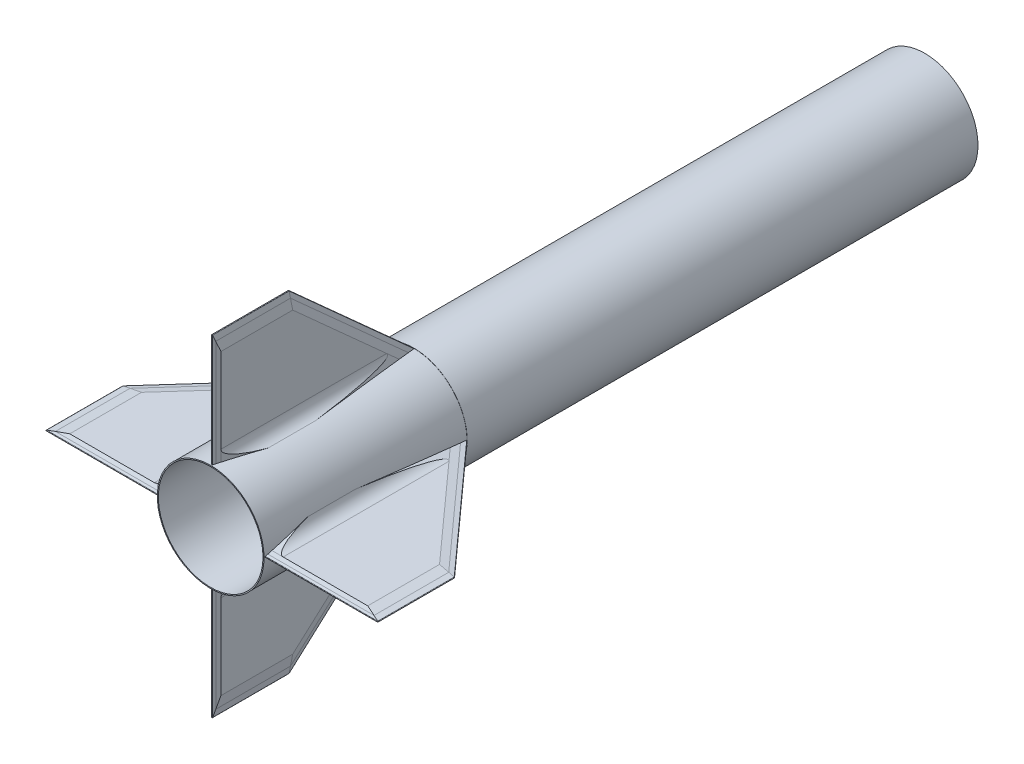
from build123d import *

# Parameters (mm, degrees)
FINBODY_DEPTH            = 3.175
CARBONFIBERX5_DEPTH      = 1.6002
CUT_EXTRUDE1_START       = 30.079279921
CUT_EXTRUDE1_OUTLINE_W   = 176
CUT_EXTRUDE1_OUTLINE_H   = 223
CUT_EXTRUDE1_DEPTH       = 3.920720079
CUT_EXTRUDE1_START_2     = 33.215803307
CUT_EXTRUDE1_2_OUTLINE_W = 176
CUT_EXTRUDE1_2_OUTLINE_H = 222
CUT_EXTRUDE1_2_DEPTH     = 3.784196693
CUT_EXTRUDE1_START_3     = -228
CUT_EXTRUDE1_3_DEPTH     = 342.694003237
CUT_EXTRUDE4_DEPTH       = 346.013585792
CUT_EXTRUDE4_DEPTH_BACK  = 346.013585792
CUT_EXTRUDE5_DEPTH       = 343.342847244
CUT_EXTRUDE5_DEPTH_BACK  = 343.342847244
SKETCH13_R               = 78.36
SKETCH13_R_2             = 77.09
BOSS_EXTRUDE1_DEPTH      = 914.4
BOSS_EXTRUDE2_REACH      = 934.78
BOSS_EXTRUDE3_START      = -56.898764407
BOSS_EXTRUDE3_DEPTH      = 70.136924263
BOSS_EXTRUDE3_START_2    = -274.543132623
BOSS_EXTRUDE3_2_DEPTH    = 262.646474264
BOSS_EXTRUDE3_START_3    = -86
BOSS_EXTRUDE3_3_DEPTH    = 99
CIRPATTERN1_COUNT        = 4
CIRPATTERN1_2_COUNT      = 4
CIRPATTERN1_3_COUNT      = 4
CIRPATTERN1_4_COUNT      = 4
CIRPATTERN1_5_COUNT      = 4
SKETCH18_W               = 519.548726742
SKETCH18_H               = 439.659397243
CUT_EXTRUDE6_DEPTH       = 615.0399
SKETCH17_R               = 78.614
SKETCH17_R_2             = 78.36
SKETCH17_R_3             = 77.09
BOSS_EXTRUDE4_DEPTH      = 0.1
SKETCH19_R               = 78.614
SKETCH19_R_2             = 77.09
BOSS_EXTRUDE5_DEPTH      = 0.1
SKETCH20_R               = 78.36
SKETCH20_R_2             = 77.09
BOSS_EXTRUDE6_DEPTH      = 914.4
SKETCH21_W               = 490.676006992
SKETCH21_H               = 455.150743556
CUT_EXTRUDE7_DEPTH       = 263.4
SKETCH22_R               = 78.36
SKETCH22_R_2             = 77.09
BOSS_EXTRUDE7_DEPTH      = 101.6


with BuildPart() as part:
    # Sketch1 → FinBody (new body)
    with BuildSketch(Plane(origin=(0, 0, 0), x_dir=(1, 0, 0), z_dir=(0, 1, 0))):
        Polygon((0, 0), (0, 304.8), (171.45, 114.3), (171.45, 0), align=None)
    extrude(amount=FINBODY_DEPTH)

    # Cut-Extrude1 3 outline → Cut-Extrude1 3 (cut)
    with BuildSketch(Plane(origin=(0, 0, 0), x_dir=(0.743294146247166, 0, -0.6689647316224498), z_dir=(0.66896473162245, 0, 0.743294146247166)).offset(CUT_EXTRUDE1_START_3)):
        with BuildLine():
            Line((193.796371055, 3.175), (199.880959022, 2.219021404))
            add(Edge.make_bspline(
                [(199.880959022, 2.219021404), (200.261348709, 2.159256568), (200.261348709, 1.5875), (200.261348709, 1.015743432), (199.880959022, 0.955978596)],
                knots=[1.675516082, 1.675516082, 1.675516082, 3.141592654, 3.141592654, 4.607669225, 4.607669225, 4.607669225], degree=2, weights=[1, 0.743144825, 1, 0.743144825, 1]))
            Line((199.880959022, 0.955978596), (193.796371055, 0))
            Line((193.796371055, 0), (203.900450199, 0))
            Line((203.900450199, 0), (203.900450199, 3.175))
            Line((203.900450199, 3.175), (193.796371055, 3.175))
        make_face()
    extrude(amount=CUT_EXTRUDE1_3_DEPTH, mode=Mode.SUBTRACT)


with BuildPart() as body_2:
    # Sketch2 → CarbonFiberx5 (new body)
    with BuildSketch(Plane(origin=(0, 3.175, 0), x_dir=(1, 0, 0), z_dir=(0, 1, 0))):
        Polygon((0, 0), (171.45, 0), (171.45, 114.3), (0, 304.8), align=None)
    extrude(amount=CARBONFIBERX5_DEPTH)


with BuildPart() as body_3:
    # Mirror2: mirrored copy
    add(body_2.part.mirror(Plane.ZX.offset(1.5875)))

    # Cut-Extrude1: read off the stored shape, not the designer's step
    # Cut-Extrude1 outline → Cut-Extrude1 (cut)
    with BuildSketch(Plane(origin=(0, 0, 0), x_dir=(0.9933229080470528, 0.11473524741114627, 0.012059160437165995), z_dir=(0.11536724122967598, -0.9878813812236809, -0.10383051710670899)).offset(CUT_EXTRUDE1_START)):
        with Locations((83, -193.5)):
            Rectangle(CUT_EXTRUDE1_OUTLINE_W, CUT_EXTRUDE1_OUTLINE_H)
    extrude(amount=CUT_EXTRUDE1_DEPTH, mode=Mode.SUBTRACT)


with BuildPart() as body_2_1:
    add(body_2.part)

    # Cut-Extrude1 2 outline → Cut-Extrude1 2 (cut)
    with BuildSketch(Plane(origin=(0, 0, 0), x_dir=(0.9933229080470528, -0.11473524741114627, 0.012059160437165995), z_dir=(0.11536724122967598, 0.9878813812236809, -0.10383051710670899)).offset(CUT_EXTRUDE1_START_2)):
        with Locations((82, 193)):
            Rectangle(CUT_EXTRUDE1_2_OUTLINE_W, CUT_EXTRUDE1_2_OUTLINE_H)
    extrude(amount=CUT_EXTRUDE1_2_DEPTH, mode=Mode.SUBTRACT)


with BuildPart() as cut_extrude4_tool:
    # Sketch11 → Cut-Extrude4 (new, two sides: drawn at the far end of the back side and taken through both)
    with BuildSketch(Plane.XY.offset(-CUT_EXTRUDE4_DEPTH_BACK)):
        with BuildLine():
            Line((156.345946429, 3.175), (165.441475206, 2.219021404))
            ThreePointArc((165.441475206, 2.219021404), (166.010099632, 1.5875), (165.441475206, 0.955978596))
            Line((165.441475206, 0.955978596), (156.345946429, 0))
            Line((156.345946429, 0), (171.45, 0))
            Line((171.45, 0), (171.45, 3.175))
            Line((171.45, 3.175), (156.345946429, 3.175))
        make_face()
        Polygon((141.121060429, 4.7752), (156.345946429, 3.175), (171.45, 3.175), (171.45, 4.7752), align=None)
        Polygon((171.45, 0), (156.345946429, 0), (141.121060429, -1.6002), (171.45, -1.6002), align=None)
    extrude(amount=CUT_EXTRUDE4_DEPTH + CUT_EXTRUDE4_DEPTH_BACK)


with BuildPart() as part_1:
    add(part.part)

    # Cut-Extrude4: cut by cut_extrude4_tool
    add(cut_extrude4_tool.part, mode=Mode.SUBTRACT)


with BuildPart() as body_2_2:
    add(body_2_1.part)

    # Cut-Extrude4: cut by cut_extrude4_tool
    add(cut_extrude4_tool.part, mode=Mode.SUBTRACT)


with BuildPart() as body_3_1:
    add(body_3.part)

    # Cut-Extrude4: cut by cut_extrude4_tool
    add(cut_extrude4_tool.part, mode=Mode.SUBTRACT)


with BuildPart() as cut_extrude5_tool:
    # Sketch12 → Cut-Extrude5 (new, two sides: drawn at the far end of the back side and taken through both)
    with BuildSketch(Plane.ZY.offset(-CUT_EXTRUDE5_DEPTH_BACK)):
        with BuildLine():
            Line((-5.924630657, 3.175), (-2.289101505, 2.2008629))
            ThreePointArc((-2.289101505, 2.2008629), (-1.818451599, 1.5875), (-2.289101505, 0.9741371))
            Line((-2.289101505, 0.9741371), (-5.924630657, 0))
            Line((-5.924630657, 0), (0, 0))
            Line((0, 0), (0, 3.175))
            Line((0, 3.175), (-5.924630657, 3.175))
        make_face()
        Polygon((-11.896658359, 4.7752), (-5.924630657, 3.175), (0, 3.175), (0, 4.7752), align=None)
        Polygon((0, 0), (-5.924630657, 0), (-11.896658359, -1.6002), (0, -1.6002), align=None)
    extrude(amount=CUT_EXTRUDE5_DEPTH + CUT_EXTRUDE5_DEPTH_BACK)


with BuildPart() as part_2:
    add(part_1.part)

    # Cut-Extrude5: cut by cut_extrude5_tool
    add(cut_extrude5_tool.part, mode=Mode.SUBTRACT)



with BuildPart() as body_2_3:
    add(body_2_2.part)

    # Cut-Extrude5: cut by cut_extrude5_tool
    add(cut_extrude5_tool.part, mode=Mode.SUBTRACT)

    # CirPattern1 4: body 2 ×4 about axis
    cirpattern1_4_axis = Axis((-78.36, 1.5875, 0), (0, 0, 1))


with BuildPart() as body_3_2:
    add(body_3_1.part)

    # Cut-Extrude5: cut by cut_extrude5_tool
    add(cut_extrude5_tool.part, mode=Mode.SUBTRACT)

    # CirPattern1 2: body 3 ×4 about axis
    cirpattern1_2_axis = Axis((-78.36, 1.5875, 0), (0, 0, 1))


with BuildPart() as body_4:
    # Sketch13 → Boss-Extrude1 (new body)
    with BuildSketch(Plane.XY):
        with Locations((-78.36, 1.5875)):
            Circle(SKETCH13_R)
        with Locations((-78.36, 1.5875)):
            Circle(SKETCH13_R_2, mode=Mode.SUBTRACT)
    extrude(amount=-BOSS_EXTRUDE1_DEPTH)


with BuildPart() as part_3:
    add(part_2.part)

    # Boss-Extrude2: up to this face of the body
    boss_extrude2_end = body_4.part.faces().sort_by_distance((-156.72, 1.5875, -457.2))[0]
    # Sketch14 → Boss-Extrude2 (add, up to the picked face)
    with BuildSketch(Plane.ZY, mode=Mode.PRIVATE) as boss_extrude2_sk1:
        with BuildLine():
            ThreePointArc((-2.289101505, 0.9741371), (-1.818451599, 1.5875), (-2.289101505, 2.2008629))
            Line((-2.289101505, 2.2008629), (-5.924630657, 3.175))
            Line((-5.924630657, 3.175), (-289.695946429, 3.175))
            Line((-289.695946429, 3.175), (-298.791475206, 2.219021404))
            ThreePointArc((-298.791475206, 2.219021404), (-299.360099632, 1.5875), (-298.791475206, 0.955978596))
            Line((-298.791475206, 0.955978596), (-289.695946429, 0))
            Line((-289.695946429, 0), (-5.924630657, 0))
            Line((-5.924630657, 0), (-2.289101505, 0.9741371))
        make_face()
    boss_extrude2_tool1 = split(extrude(boss_extrude2_sk1.sketch, amount=BOSS_EXTRUDE2_REACH, mode=Mode.PRIVATE), bisect_by=boss_extrude2_end, keep=Keep.BOTH, mode=Mode.PRIVATE)
    # Sketch14 → Boss-Extrude2 (add, up to the picked face)
    with BuildSketch(Plane.ZY, mode=Mode.PRIVATE) as boss_extrude2_sk2:
        Polygon((-289.695946429, 3.175), (-5.924630657, 3.175), (-11.896658359, 4.7752), (-274.471060429, 4.7752), align=None)
    boss_extrude2_tool2 = split(extrude(boss_extrude2_sk2.sketch, amount=BOSS_EXTRUDE2_REACH, mode=Mode.PRIVATE), bisect_by=boss_extrude2_end, keep=Keep.BOTH, mode=Mode.PRIVATE)
    # Sketch14 → Boss-Extrude2 (add, up to the picked face)
    with BuildSketch(Plane.ZY, mode=Mode.PRIVATE) as boss_extrude2_sk3:
        Polygon((-11.896658359, -1.6002), (-5.924630657, 0), (-289.695946429, 0), (-274.471060429, -1.6002), align=None)
    boss_extrude2_tool3 = split(extrude(boss_extrude2_sk3.sketch, amount=BOSS_EXTRUDE2_REACH, mode=Mode.PRIVATE), bisect_by=boss_extrude2_end, keep=Keep.BOTH, mode=Mode.PRIVATE)
    add(boss_extrude2_tool1.solids().sort_by(Axis((0, 1.5875, -149.762129), (-1, 0, 0)))[0])
    add(boss_extrude2_tool1.solids().sort_by(Axis((0, 1.5875, -149.762129), (-1, 0, 0)))[1])
    add(boss_extrude2_tool2.solids().sort_by(Axis((0, 3.964753, -145.52699), (-1, 0, 0)))[0])
    add(boss_extrude2_tool3.solids().sort_by(Axis((0, -0.789753, -145.52699), (-1, 0, 0)))[0])

    # CirPattern1 3: part ×4 about axis
    cirpattern1_3_axis = Axis((-78.36, 1.5875, 0), (0, 0, 1))


with BuildPart() as body_5:
    # Boss-Extrude3: read off the stored shape, not the designer's step
    # Boss-Extrude3 outline → Boss-Extrude3 (new body)
    with BuildSketch(Plane.XY.offset(-80).offset(BOSS_EXTRUDE3_START)):
        with BuildLine():
            Line((-0.064864974, 4.7752), (16.477718228, 4.7752))
            ThreePointArc((16.477718228, 4.7752), (4.644384042, 8.896211353), (-2.069233135, 19.476281152))
            ThreePointArc((-2.069233135, 19.476281152), (-0.718318458, 12.173287045), (-0.064864974, 4.7752))
        make_face()
    extrude(amount=BOSS_EXTRUDE3_DEPTH)

    # Boss-Extrude3 2 outline → Boss-Extrude3 2 (add)
    with BuildSketch(Plane.XY.offset(BOSS_EXTRUDE3_START_2)):
        with BuildLine():
            Line((-0.064864974, 4.7752), (16.477718228, 4.7752))
            ThreePointArc((16.477718228, 4.7752), (4.644384042, 8.896211353), (-2.069233135, 19.476281152))
            ThreePointArc((-2.069233135, 19.476281152), (-0.718318458, 12.173287045), (-0.064864974, 4.7752))
        make_face()
    extrude(amount=BOSS_EXTRUDE3_2_DEPTH)

    # Boss-Extrude3 3 outline → Boss-Extrude3 3 (cut)
    with BuildSketch(Plane(origin=(0, 0, 0), x_dir=(0.07615017369348556, 0.9968113565300682, 0.023838425684957087), z_dir=(0.9512887817175956, -0.0797942322018656, 0.29779612872830835)).offset(BOSS_EXTRUDE3_START_3)):
        Polygon((4.471436504, -11.333981124), (17.665108608, -63.094766675), (20, -72.254901297), (20, -9), (3.876511575, -9), align=None)
        Polygon((20, -268), (20, -100.295878551), (15.993154751, -130.028664246), (-1.789641954, -261.985865142), (-2.600117902, -268), align=None)
    extrude(amount=BOSS_EXTRUDE3_3_DEPTH, mode=Mode.SUBTRACT)


with BuildPart() as body_6:
    # Mirror3: mirrored copy
    add(body_5.part.mirror(Plane.ZX.offset(1.5875)))

    # CirPattern1: body 6 ×4 about axis
    cirpattern1_axis = Axis((-78.36, 1.5875, 0), (0, 0, 1))


with BuildPart() as body_6_1:
    add(body_6.part)
    for i in range(1, CIRPATTERN1_COUNT):
        add(body_6.part.rotate(cirpattern1_axis, i * 360 / CIRPATTERN1_COUNT))


with BuildPart() as body_3_3:
    add(body_3_2.part)
    for i in range(1, CIRPATTERN1_2_COUNT):
        add(body_3_2.part.rotate(cirpattern1_2_axis, i * 360 / CIRPATTERN1_2_COUNT))


with BuildPart() as part_4:
    add(part_3.part)
    for i in range(1, CIRPATTERN1_3_COUNT):
        add(part_3.part.rotate(cirpattern1_3_axis, i * 360 / CIRPATTERN1_3_COUNT))


with BuildPart() as body_2_4:
    add(body_2_3.part)
    for i in range(1, CIRPATTERN1_4_COUNT):
        add(body_2_3.part.rotate(cirpattern1_4_axis, i * 360 / CIRPATTERN1_4_COUNT))


with BuildPart() as body_5_1:
    add(body_5.part)

    # CirPattern1 5: body 5 ×4 about axis
    cirpattern1_5_axis = Axis((-78.36, 1.5875, 0), (0, 0, 1))


with BuildPart() as body_5_2:
    add(body_5_1.part)
    for i in range(1, CIRPATTERN1_5_COUNT):
        add(body_5_1.part.rotate(cirpattern1_5_axis, i * 360 / CIRPATTERN1_5_COUNT))


with BuildPart() as body_4_1:
    add(body_4.part)

    # Sketch18 → Cut-Extrude6 (cut)
    with BuildSketch(Plane(origin=(0, 0, -914.4), x_dir=(-1, 0, 0), z_dir=(0, 0, -1))):
        with Locations((83.18552997, 2.793882493)):
            Rectangle(SKETCH18_W, SKETCH18_H)
    extrude(amount=-CUT_EXTRUDE6_DEPTH, mode=Mode.SUBTRACT)

    # Sketch17 → Boss-Extrude4 (add)
    # profile 1 of 2: a face of its own
    with BuildSketch(Plane.XY):
        with Locations((-78.36, 1.5875)):
            Circle(SKETCH17_R)
        with Locations((-78.36, 1.5875)):
            Circle(SKETCH17_R_2, mode=Mode.SUBTRACT)
    # profile 2 of 2: a face of its own
    with BuildSketch(Plane.XY):
        with Locations((-78.36, 1.5875)):
            Circle(SKETCH17_R_2)
        with Locations((-78.36, 1.5875)):
            Circle(SKETCH17_R_3, mode=Mode.SUBTRACT)
    extrude(amount=-BOSS_EXTRUDE4_DEPTH)

    # Sketch19 → Boss-Extrude5 (add)
    with BuildSketch(Plane(origin=(0, 0, -299.360099632), x_dir=(-1, 0, 0), z_dir=(0, 0, -1))):
        with Locations(Location((78.36, 1.5875, 0), (0, 0, 180))):
            Circle(SKETCH19_R)
        with Locations(Location((78.36, 1.5875, 0), (0, 0, 180))):
            Circle(SKETCH19_R_2, mode=Mode.SUBTRACT)
    extrude(amount=-BOSS_EXTRUDE5_DEPTH)

    # Sketch20 → Boss-Extrude6 (add)
    with BuildSketch(Plane(origin=(0, 0, -299.360099632), x_dir=(-1, 0, 0), z_dir=(0, 0, -1))):
        with Locations(Location((78.36, 1.5875, 0), (0, 0, 180))):
            Circle(SKETCH20_R)
        with Locations(Location((78.36, 1.5875, 0), (0, 0, 180))):
            Circle(SKETCH20_R_2, mode=Mode.SUBTRACT)
    extrude(amount=BOSS_EXTRUDE6_DEPTH)

    # Sketch21 → Cut-Extrude7 (cut)
    with BuildSketch(Plane(origin=(0, 0, -1213.760099632), x_dir=(-1, 0, 0), z_dir=(0, 0, -1))):
        with Locations((78.493553622, -8.429021645)):
            Rectangle(SKETCH21_W, SKETCH21_H)
    extrude(amount=-CUT_EXTRUDE7_DEPTH, mode=Mode.SUBTRACT)

    # Sketch22 → Boss-Extrude7 (add)
    with BuildSketch(Plane(origin=(0, 0, -950.360099632), x_dir=(-1, 0, 0), z_dir=(0, 0, -1))):
        with Locations(Location((78.36, 1.5875, 0), (0, 0, 180))):
            Circle(SKETCH22_R)
        with Locations(Location((78.36, 1.5875, 0), (0, 0, 180))):
            Circle(SKETCH22_R_2, mode=Mode.SUBTRACT)
    extrude(amount=BOSS_EXTRUDE7_DEPTH)


solid = Compound([body_6_1.part, body_3_3.part, part_4.part, body_2_4.part, body_5_2.part, body_4_1.part])
